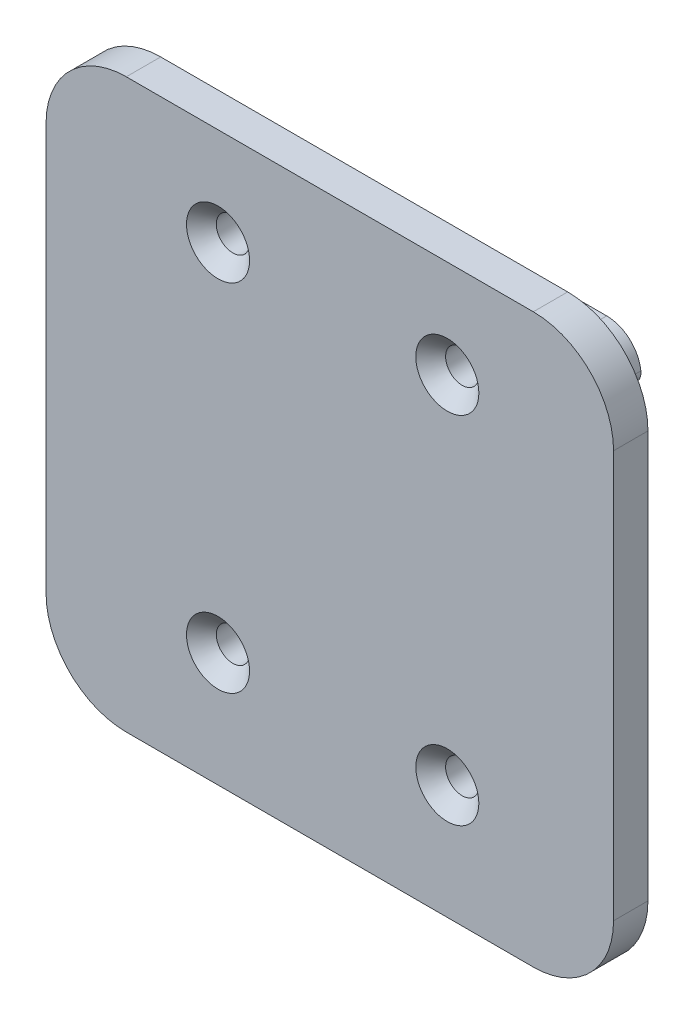
from build123d import *

# Parameters (mm, degrees)
EXTRUDE_1_DEPTH                = 3
SKETCH_3_W                     = 40.5
SKETCH_3_H                     = 3
EXTRUDE_3_DEPTH                = 4.4
EXTRUDE_6_DEPTH                = 4.4
SKETCH_2_W                     = 2.5
SKETCH_2_H                     = 11.99
EXTRUDE_2_DEPTH                = 1.8
FILLET_1_R                     = 3
FILLET_2_R                     = 1.2
HOLE_WIZARD_M2_5_1_D           = 2.9
HOLE_WIZARD_M2_5_1_CSINK_D     = 5.5
HOLE_WIZARD_M2_5_1_CSINK_ANGLE = 90
CHAMFER_3_SIZE                 = 1


# Some blends are built 0.0001 mm under size
with BuildPart() as part:
    # 草图1 → 凸台-拉伸1 (new body)
    with BuildSketch(Plane.XY):
        with BuildLine():
            Line((96.518, -36.187), (61.018, -36.187))
            ThreePointArc((61.018, -36.187), (56.068252532, -38.237252532), (54.018, -43.187))
            Line((54.018, -43.187), (54.018, -78.687))
            ThreePointArc((54.018, -78.687), (56.068252532, -83.636747468), (61.018, -85.687))
            Line((61.018, -85.687), (96.518, -85.687))
            ThreePointArc((96.518, -85.687), (101.467747468, -83.636747468), (103.518, -78.687))
            Line((103.518, -78.687), (103.518, -43.187))
            ThreePointArc((103.518, -43.187), (101.467747468, -38.237252532), (96.518, -36.187))
        make_face()
    extrude(amount=EXTRUDE_1_DEPTH)

    # 草图3 → 凸台-拉伸3 (add)
    with BuildSketch(Plane(origin=(0, 0, 0), x_dir=(-1, 0, 0), z_dir=(0, 0, -1))):
        with Locations((-78.768, -58.187)):
            Rectangle(SKETCH_3_W, SKETCH_3_H)
    extrude(amount=EXTRUDE_3_DEPTH)

    # 草图4 → 凸台-拉伸6 (add)
    with BuildSketch(Plane(origin=(0, 0, 0), x_dir=(-1, 0, 0), z_dir=(0, 0, -1))):
        with BuildLine():
            Line((-79.018, -44.697), (-79.018, -40.697))
            Line((-79.018, -40.697), (-98.518, -40.697))
            Line((-98.518, -40.697), (-98.518, -44.697))
            Line((-98.518, -44.697), (-91.518, -44.697))
            ThreePointArc((-91.518, -44.697), (-89.018, -42.197), (-86.518, -44.697))
            Line((-86.518, -44.697), (-79.018, -44.697))
        make_face()
        with BuildLine():
            Line((-59.018, -40.697), (-79.018, -40.697))
            Line((-79.018, -40.697), (-79.018, -44.697))
            Line((-79.018, -44.697), (-71.518, -44.697))
            ThreePointArc((-71.518, -44.697), (-69.018, -42.197), (-66.518, -44.697))
            Line((-66.518, -44.697), (-59.018, -44.697))
            Line((-59.018, -44.697), (-59.018, -40.697))
        make_face()
        with BuildLine():
            ThreePointArc((-89.018, -47.197), (-87.250233047, -46.464766953), (-86.518, -44.697))
            Line((-86.518, -44.697), (-87.718, -44.697))
            ThreePointArc((-87.718, -44.697), (-88.098761184, -45.616238816), (-89.018, -45.997))
            Line((-89.018, -45.997), (-89.018, -47.197))
        make_face()
        with BuildLine():
            Line((-90.318, -44.697), (-91.518, -44.697))
            ThreePointArc((-91.518, -44.697), (-90.785766953, -46.464766953), (-89.018, -47.197))
            Line((-89.018, -47.197), (-89.018, -45.997))
            ThreePointArc((-89.018, -45.997), (-89.937238816, -45.616238816), (-90.318, -44.697))
        make_face()
        with BuildLine():
            Line((-87.718, -44.697), (-86.518, -44.697))
            ThreePointArc((-86.518, -44.697), (-89.018, -42.197), (-91.518, -44.697))
            Line((-91.518, -44.697), (-90.318, -44.697))
            ThreePointArc((-90.318, -44.697), (-89.018, -43.397), (-87.718, -44.697))
        make_face()
        with BuildLine():
            ThreePointArc((-66.518, -44.697), (-69.018, -42.197), (-71.518, -44.697))
            Line((-71.518, -44.697), (-70.318, -44.697))
            ThreePointArc((-70.318, -44.697), (-69.018, -43.397), (-67.718, -44.697))
            Line((-67.718, -44.697), (-66.518, -44.697))
        make_face()
        with BuildLine():
            Line((-70.318, -44.697), (-71.518, -44.697))
            ThreePointArc((-71.518, -44.697), (-70.785766953, -46.464766953), (-69.018, -47.197))
            Line((-69.018, -47.197), (-69.018, -45.997))
            ThreePointArc((-69.018, -45.997), (-69.937238816, -45.616238816), (-70.318, -44.697))
        make_face()
        with BuildLine():
            ThreePointArc((-69.018, -47.197), (-67.250233047, -46.464766953), (-66.518, -44.697))
            Line((-66.518, -44.697), (-67.718, -44.697))
            ThreePointArc((-67.718, -44.697), (-68.098761184, -45.616238816), (-69.018, -45.997))
            Line((-69.018, -45.997), (-69.018, -47.197))
        make_face()
        with BuildLine():
            ThreePointArc((-69.018, -73.197), (-70.785766953, -73.929233047), (-71.518, -75.697))
            Line((-71.518, -75.697), (-70.318, -75.697))
            ThreePointArc((-70.318, -75.697), (-69.937238816, -74.777761184), (-69.018, -74.397))
            Line((-69.018, -74.397), (-69.018, -73.197))
        make_face()
        with BuildLine():
            ThreePointArc((-66.518, -75.697), (-67.250233047, -73.929233047), (-69.018, -73.197))
            Line((-69.018, -73.197), (-69.018, -74.397))
            ThreePointArc((-69.018, -74.397), (-68.098761184, -74.777761184), (-67.718, -75.697))
            Line((-67.718, -75.697), (-66.518, -75.697))
        make_face()
        with BuildLine():
            Line((-70.318, -75.697), (-71.518, -75.697))
            ThreePointArc((-71.518, -75.697), (-69.018, -78.197), (-66.518, -75.697))
            Line((-66.518, -75.697), (-67.718, -75.697))
            ThreePointArc((-67.718, -75.697), (-69.018, -76.997), (-70.318, -75.697))
        make_face()
        with BuildLine():
            Line((-71.518, -75.697), (-79.018, -75.697))
            Line((-79.018, -75.697), (-79.018, -79.697))
            Line((-79.018, -79.697), (-59.018, -79.697))
            Line((-59.018, -79.697), (-59.018, -75.697))
            Line((-59.018, -75.697), (-66.518, -75.697))
            ThreePointArc((-66.518, -75.697), (-69.018, -78.197), (-71.518, -75.697))
        make_face()
        with BuildLine():
            Line((-79.018, -79.697), (-79.018, -75.697))
            Line((-79.018, -75.697), (-86.518, -75.697))
            ThreePointArc((-86.518, -75.697), (-89.018, -78.197), (-91.518, -75.697))
            Line((-91.518, -75.697), (-98.518, -75.697))
            Line((-98.518, -75.697), (-98.518, -79.697))
            Line((-98.518, -79.697), (-79.018, -79.697))
        make_face()
        with BuildLine():
            ThreePointArc((-91.518, -75.697), (-89.018, -78.197), (-86.518, -75.697))
            Line((-86.518, -75.697), (-87.718, -75.697))
            ThreePointArc((-87.718, -75.697), (-89.018, -76.997), (-90.318, -75.697))
            Line((-90.318, -75.697), (-91.518, -75.697))
        make_face()
        with BuildLine():
            Line((-87.718, -75.697), (-86.518, -75.697))
            ThreePointArc((-86.518, -75.697), (-87.250233047, -73.929233047), (-89.018, -73.197))
            Line((-89.018, -73.197), (-89.018, -74.397))
            ThreePointArc((-89.018, -74.397), (-88.098761184, -74.777761184), (-87.718, -75.697))
        make_face()
        with BuildLine():
            Line((-89.018, -74.397), (-89.018, -73.197))
            ThreePointArc((-89.018, -73.197), (-90.785766953, -73.929233047), (-91.518, -75.697))
            Line((-91.518, -75.697), (-90.318, -75.697))
            ThreePointArc((-90.318, -75.697), (-89.937238816, -74.777761184), (-89.018, -74.397))
        make_face()
    extrude(amount=EXTRUDE_6_DEPTH)

    # 草图2 → 凸台-拉伸2 (add)
    with BuildSketch(Plane(origin=(0, 0, 0), x_dir=(-1, 0, 0), z_dir=(0, 0, -1))):
        with Locations((-55.268, -50.692)):
            Rectangle(SKETCH_2_W, SKETCH_2_H)
    extrude(amount=EXTRUDE_2_DEPTH)

    # 圆角1
    fillet_1_edges = [part.edges().sort_by_distance(p)[0] for p in [
        (59.018, -40.697, -2.2),
        (98.518, -40.697, -2.2),
        (59.018, -79.697, -2.2),
        (98.518, -79.697, -2.2),
    ]]
    fillet(fillet_1_edges, radius=FILLET_1_R)

    # 圆角2
    # the kernel refuses this fillet: 1.2 mm, written as the material it adds along each edge
    with BuildSketch(Plane(origin=(91.518, -44.697, 2.5), x_dir=(-0.16439898730516103, -0.9863939238321764, 0), z_dir=(0, 0, -1)), Plane(origin=(71.518, -44.697, 2.5), x_dir=(-0.16439898730516103, -0.9863939238321764, 0), z_dir=(0, 0, -1))) as fillet_2_piece_1:
        with BuildLine():
            CenterArc((1.019273721, -1.183672709), FILLET_2_R, 99.462322208, 71.075355584)
            Line((-0.164398987, -0.986393924), (0, 0))
            ThreePointArc((0, 0), (0.410997468, -0.03401519), (0.821994937, 0))
        make_face()
    extrude(amount=6.9)
    with BuildSketch(Plane(origin=(86.518, -44.697, 2.5), x_dir=(-1, 0, 0), z_dir=(0, 0, -1)), Plane(origin=(66.518, -44.697, 2.5), x_dir=(-1, 0, 0), z_dir=(0, 0, -1))) as fillet_2_piece_2:
        with BuildLine():
            CenterArc((1, -1.2), FILLET_2_R, 90, 71.075355584)
            ThreePointArc((-0.135135135, -0.810810811), (-0.03401519, -0.410997468), (0, 0))
            Line((0, 0), (1, 0))
        make_face()
    extrude(amount=6.9)
    with BuildSketch(Plane(origin=(71.518, -75.697, 2.5), x_dir=(-0.16439898730513022, 0.9863939238321816, 0), z_dir=(0, 0, -1)), Plane(origin=(91.518, -75.697, 2.5), x_dir=(-0.16439898730515545, 0.9863939238321774, 0), z_dir=(0, 0, -1))) as fillet_2_piece_3:
        with BuildLine():
            CenterArc((1.019273721, 1.183672709), FILLET_2_R, 189.462322208, 71.075355584)
            Line((-0.164398987, 0.986393924), (0, 0))
            ThreePointArc((0, 0), (0.410997468, 0.03401519), (0.821994937, 0))
        make_face()
    extrude(amount=6.9)
    with BuildSketch(Plane(origin=(66.518, -75.697, 2.5), x_dir=(-1, 0, 0), z_dir=(0, 0, -1)), Plane(origin=(86.518, -75.697, 2.5), x_dir=(-1, 0, 0), z_dir=(0, 0, -1))) as fillet_2_piece_4:
        with BuildLine():
            CenterArc((1, 1.2), FILLET_2_R, 198.924644416, 71.075355584)
            ThreePointArc((-0.135135135, 0.810810811), (-0.03401519, 0.410997468), (0, 0))
            Line((0, 0), (1, 0))
        make_face()
    extrude(amount=6.9)
    # the kernel refuses this fillet: 1.2 mm, written as the material it takes off along each edge
    with BuildSketch(Plane(origin=(59.018, -76.697, -4.4), x_dir=(0, 0, 1), z_dir=(0, 1, 0))) as fillet_2_2_piece_1_section:
        with BuildLine():
            CenterArc((FILLET_2_R, FILLET_2_R), FILLET_2_R, 180, 90)
            Line((0, FILLET_2_R), (0, 0))
            Line((0, 0), (FILLET_2_R, 0))
        make_face()
    fillet_2_2_piece_1 = extrude(amount=4, mode=Mode.PRIVATE)
    fillet_2_2_piece_1 = fillet_2_2_piece_1 - Plane(origin=(62.018, -76.697, -3.946727239), x_dir=(-1, 0, 0), z_dir=(0, 0, -1)) * Cylinder(3, 13, mode=Mode.PRIVATE)
    add(fillet_2_2_piece_1, mode=Mode.SUBTRACT)
    with BuildSketch(Plane(origin=(98.518, -72.697, -4.4), x_dir=(0, 0, 1), z_dir=(0, -1, 0))) as fillet_2_2_piece_2_section:
        with BuildLine():
            CenterArc((FILLET_2_R, FILLET_2_R), FILLET_2_R, 180, 90)
            Line((0, FILLET_2_R), (0, 0))
            Line((0, 0), (FILLET_2_R, 0))
        make_face()
    fillet_2_2_piece_2 = extrude(amount=4, mode=Mode.PRIVATE)
    fillet_2_2_piece_2 = fillet_2_2_piece_2 - Plane(origin=(95.518, -76.697, -3.946727241), x_dir=(0, -1, 0), z_dir=(0, 0, -1)) * Cylinder(3, 13, mode=Mode.PRIVATE)
    add(fillet_2_2_piece_2, mode=Mode.SUBTRACT)
    with BuildSketch(Plane(origin=(98.518, -43.697, -4.4), x_dir=(0, 0, 1), z_dir=(0, -1, 0))) as fillet_2_2_piece_3_section:
        with BuildLine():
            CenterArc((FILLET_2_R, FILLET_2_R), FILLET_2_R, 180, 90)
            Line((0, FILLET_2_R), (0, 0))
            Line((0, 0), (FILLET_2_R, 0))
        make_face()
    fillet_2_2_piece_3 = extrude(amount=4, mode=Mode.PRIVATE)
    fillet_2_2_piece_3 = fillet_2_2_piece_3 - Plane(origin=(95.518, -43.697, -3.946727241), x_dir=(0, 1, 0), z_dir=(0, 0, -1)) * Cylinder(3, 13, mode=Mode.PRIVATE)
    add(fillet_2_2_piece_3, mode=Mode.SUBTRACT)
    with BuildSketch(Plane(origin=(98.518, -44.697, 0), x_dir=(-1, 0, 0), z_dir=(0, 0, -1)), Plane(origin=(59.018, -75.697, 0), x_dir=(1, 0, 0), z_dir=(0, 0, -1))) as fillet_2_2_piece_4:
        with BuildLine():
            CenterArc((1.211145618, 1.2), FILLET_2_R, 173.620629792, 96.379370208)
            Line((0.01857603, 1.333333333), (-0.100680929, 1.346666667))
            ThreePointArc((-0.100680929, 1.346666667), (-0.12, 1), (-0.12, 0))
            Line((-0.12, 0), (0, -0.12))
            Line((0, -0.12), (1.211145618, -0.12))
            Line((1.211145618, -0.12), (1.211145618, 0))
        make_face()
    extrude(amount=7.73365682, mode=Mode.SUBTRACT)
    with BuildSketch(Plane(origin=(98.518, -75.697, 0), x_dir=(-0.013930670585512008, -0.9999029635004779, 0), z_dir=(0, 0, -1))) as fillet_2_2_piece_5:
        with BuildLine():
            CenterArc((1.216755627, 1.194311288), FILLET_2_R, 179.201805551, 96.379370208)
            Line((0.016872071, 1.211028093), (-0.103116285, 1.212699773))
            Line((-0.103116285, 1.212699773), (-0.119988356, 0.00167168))
            Line((-0.119988356, 0.00167168), (-0.00167168, -0.119988356))
            ThreePointArc((-0.00167168, -0.119988356), (0.998231283, -0.133919026), (1.345133438, -0.119431129))
            Line((1.345133438, -0.119431129), (1.333462728, 0))
        make_face()
    extrude(amount=7.73365682, mode=Mode.SUBTRACT)

    # M2.5 平头机械螺钉的锥形沉头孔1 (through all)
    with Locations(Plane.XY.offset(3)):
        with Locations((69.018, -44.697), (69.018, -75.697), (89.018, -75.697), (89.018, -44.697)):
            CounterSinkHole(HOLE_WIZARD_M2_5_1_D / 2, HOLE_WIZARD_M2_5_1_CSINK_D / 2, counter_sink_angle=HOLE_WIZARD_M2_5_1_CSINK_ANGLE)

    # 倒角3
    chamfer_3_edges = [part.edges().sort_by_distance(p)[0] for p in [
        (59.018, -44.697, -2.2),
        (56.518, -44.697, -0.9),
        (56.518, -56.687, -0.9),
        (58.518, -56.687, -2.2),
    ]]
    chamfer(chamfer_3_edges, length=CHAMFER_3_SIZE - 0.0001)  # a hair under: the kernel refuses the full size


solid = part.part
